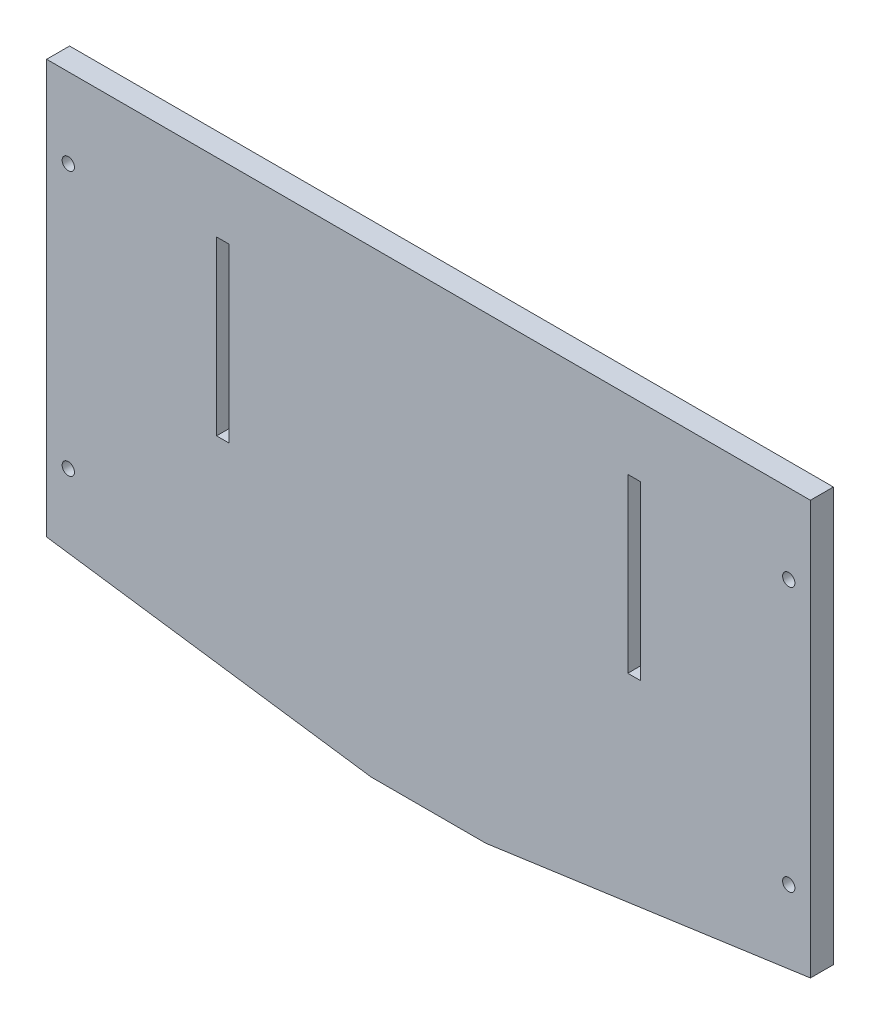
from build123d import *

# Parameters (mm, degrees)
SKETCH1_W            = 211.1756
SKETCH1_H            = 127
BOSS_EXTRUDE1_DEPTH  = 6.35
M3_CLEARANCE_HOLE1_D = 3.4
SKETCH4_W            = 3.5052
SKETCH4_H            = 47.625
CUT_EXTRUDE1_DEPTH   = 247.50447569
CUT_EXTRUDE2_DEPTH   = 247.50447569


with BuildPart() as part:
    # Sketch1 → Boss-Extrude1 (new body)
    with BuildSketch(Plane.XY):
        with Locations((105.5878, 63.5)):
            Rectangle(SKETCH1_W, SKETCH1_H)
    extrude(amount=BOSS_EXTRUDE1_DEPTH)

    # M3 Clearance Hole1 (through all)
    with Locations(Plane.XY.offset(6.35)):
        with Locations((5.9944, 105.0036), (5.9944, 31.9786), (205.1812, 31.9786), (205.1812, 105.0036)):
            Hole(M3_CLEARANCE_HOLE1_D / 2)

    # Sketch4 → Cut-Extrude1 (cut, through all)
    with BuildSketch(Plane.XY.offset(6.35)):
        with Locations((48.7426, 84.1375)):
            Rectangle(SKETCH4_W, SKETCH4_H)
        with Locations((162.433, 84.1375)):
            Rectangle(SKETCH4_W, SKETCH4_H)
    extrude(amount=-CUT_EXTRUDE1_DEPTH, mode=Mode.SUBTRACT)

    # Sketch5 → Cut-Extrude2 (cut, through all)
    with BuildSketch(Plane.XY.offset(6.35)):
        Polygon((0, 12.608311795), (89.7128, 0), (0, 0), align=None)
        Polygon((121.4628, 0), (211.1756, 0), (211.1756, 12.608311795), align=None)
    extrude(amount=-CUT_EXTRUDE2_DEPTH, mode=Mode.SUBTRACT)


solid = part.part
